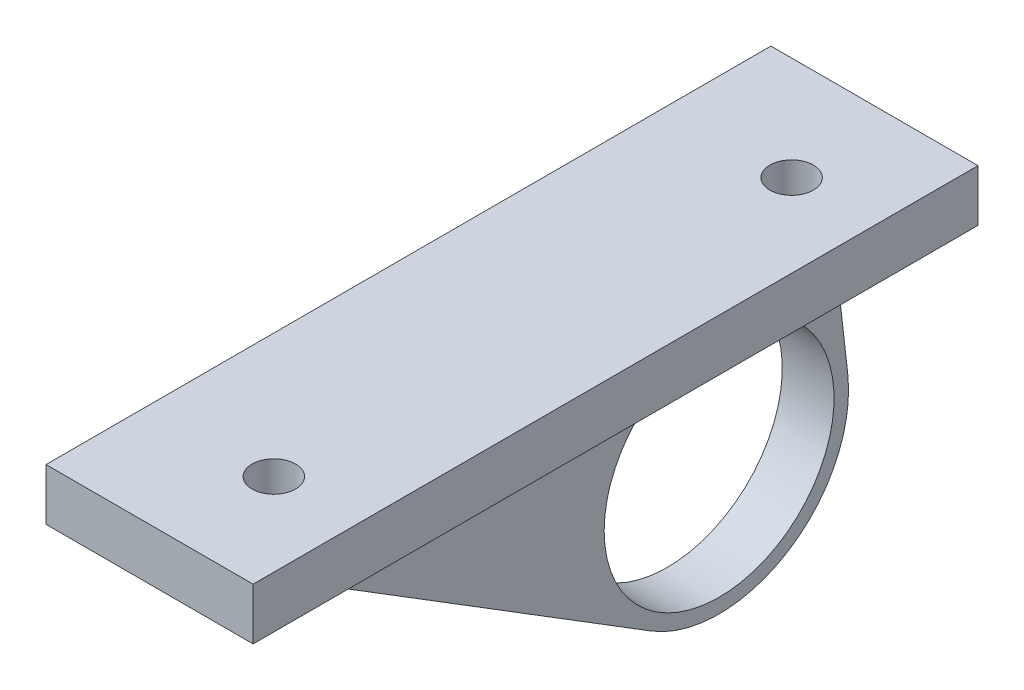
from build123d import *

# Parameters (mm, degrees)
SKETCH_1_W          = 20000
SKETCH_1_H          = 70000
SKETCH_1_R          = 2100
EXTRUDE_1_DEPTH     = 5000
EXTRUDE_4_DEPTH     = 5000
SKETCH_2_7_R        = 11100
EXTRUDE_5_DEPTH     = 5000
SKETCH_3_W          = 17634.57068131
SKETCH_3_H          = 22931.716444608
CUT_EXTRUDE_1_DEPTH = 24449


with BuildPart() as part:
    # 草圖1 → 填料-伸長1 (new body)
    with BuildSketch(Plane(origin=(0, 0, 0), x_dir=(1, 0, 0), z_dir=(0, 1, 0))):
        Rectangle(SKETCH_1_W, SKETCH_1_H)
        with Locations((2000, 25000)):
            Circle(SKETCH_1_R, mode=Mode.SUBTRACT)
        with Locations((2000, -25000)):
            Circle(SKETCH_1_R, mode=Mode.SUBTRACT)
    extrude(amount=EXTRUDE_1_DEPTH)

    # 草圖2<7> → 填料-伸長5 (add)
    with BuildSketch(Plane.ZY.offset(10000)):
        with BuildLine():
            Line((35000, 0), (-35000, 0))
            Line((-35000, 0), (-37418.496439194, -21074.887306309))
            ThreePointArc((-37418.496439194, -21074.887306309), (-31692.464058642, -33057.505615617), (-18412.167206629, -33123.109671211))
            Line((-18412.167206629, -33123.109671211), (35000, 0))
        make_face()
        with Locations((-25000, -22500)):
            Circle(SKETCH_2_7_R, mode=Mode.SUBTRACT)
    extrude(amount=-EXTRUDE_5_DEPTH)


with BuildPart() as body_2:
    # 草圖2 → 填料-伸長4 (new body)
    with BuildSketch(Plane.ZY.offset(10000)):
        with BuildLine():
            ThreePointArc((-37500, 27500), (-37423.54668342, 26119.605924064), (-37195.12195122, 24756.097560976))
            Line((-37195.12195122, 24756.097560976), (-37500, 27500))
        make_face()
    extrude(amount=-EXTRUDE_4_DEPTH)

    # 草圖3 → 除料-伸長1 (cut)
    with BuildSketch(Plane.ZY.offset(10000)):
        with Locations((-31332.50292694, 16465.858222304)):
            Rectangle(SKETCH_3_W, SKETCH_3_H)
    extrude(amount=-CUT_EXTRUDE_1_DEPTH, mode=Mode.SUBTRACT)


solid = part.part
